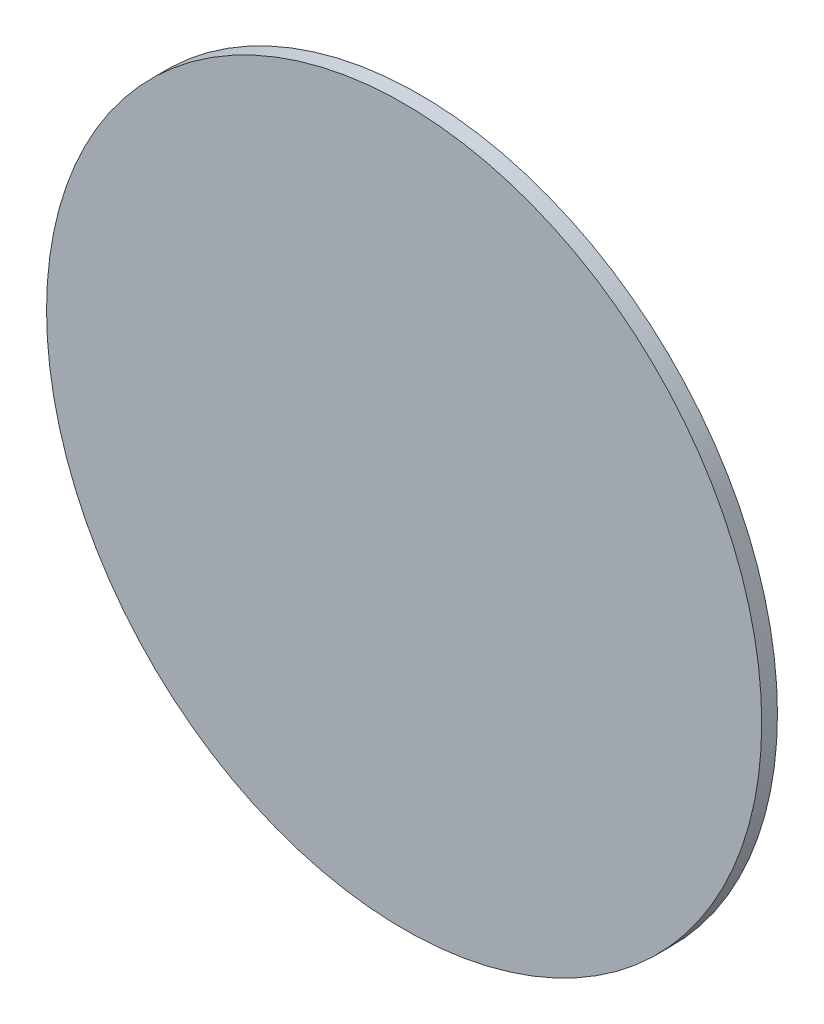
from build123d import *

# Parameters (mm, degrees)
SKETCH_1_R      = 125
EXTRUDE_1_DEPTH = 5.5


with BuildPart() as part:
    # ｽｹｯﾁ1 → ﾎﾞｽ - 押し出し1 (new body)
    with BuildSketch(Plane.XY):
        Circle(SKETCH_1_R)
    extrude(amount=EXTRUDE_1_DEPTH)


solid = part.part
